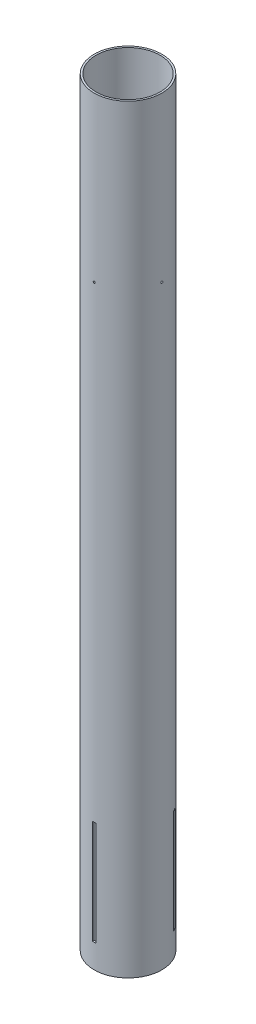
from build123d import *

# Parameters (mm, degrees)
SKETCH1_R                 = 53.721
SKETCH1_R_2               = 50.8
BODY_TUBE_EXTRUSION_DEPTH = 1206.5
ENGINE_BLOCK_HOLE_REACH   = 1214.465
SKETCH2_R                 = 1.6383
CIRPATTERN1_COUNT         = 4
SKETCH3_W                 = 5.334
SKETCH3_H                 = 165.1
FIN_TAB_SLOTS_DEPTH       = 2.54
CIRPATTERN2_COUNT         = 3


with BuildPart() as part:
    # Sketch1 → Body Tube Extrusion (new body)
    with BuildSketch(Plane(origin=(0, 0, 0), x_dir=(1, 0, 0), z_dir=(0, 1, 0))):
        Circle(SKETCH1_R)
        Circle(SKETCH1_R_2, mode=Mode.SUBTRACT)
    extrude(amount=BODY_TUBE_EXTRUSION_DEPTH)

    # Sketch2 → Engine Block Hole (cut, up to next)
    with BuildSketch(Plane.XY.offset(53.721), mode=Mode.PRIVATE) as engine_block_hole_sk1:
        with Locations((0, 946.15)):
            Circle(SKETCH2_R)
    engine_block_hole_tool1 = extrude(engine_block_hole_sk1.sketch, amount=-ENGINE_BLOCK_HOLE_REACH, mode=Mode.PRIVATE) & part.part
    engine_block_hole = engine_block_hole_tool1.solids().sort_by_distance((0, 946.15, 53.721))[0]
    add(engine_block_hole, mode=Mode.SUBTRACT)

    # CirPattern1: Engine Block Hole ×4 about axis
    cirpattern1_axis = Axis((0, 1206.5, 0), (0, -1, 0))
    for i in range(1, CIRPATTERN1_COUNT):
        add(engine_block_hole.rotate(cirpattern1_axis, i * 360 / CIRPATTERN1_COUNT), mode=Mode.SUBTRACT)

    # Sketch3 → Fin Tab Slots (cut)
    with BuildSketch(Plane.XY.offset(53.721)):
        with Locations((0, 120.65)):
            Rectangle(SKETCH3_W, SKETCH3_H)
    fin_tab_slots = extrude(amount=-FIN_TAB_SLOTS_DEPTH, mode=Mode.SUBTRACT)

    # CirPattern2: Fin Tab Slots ×3 about axis
    cirpattern2_axis = Axis((0, 1206.5, 0), (0, -1, 0))
    for i in range(1, CIRPATTERN2_COUNT):
        add(fin_tab_slots.rotate(cirpattern2_axis, i * 360 / CIRPATTERN2_COUNT), mode=Mode.SUBTRACT)


solid = part.part
